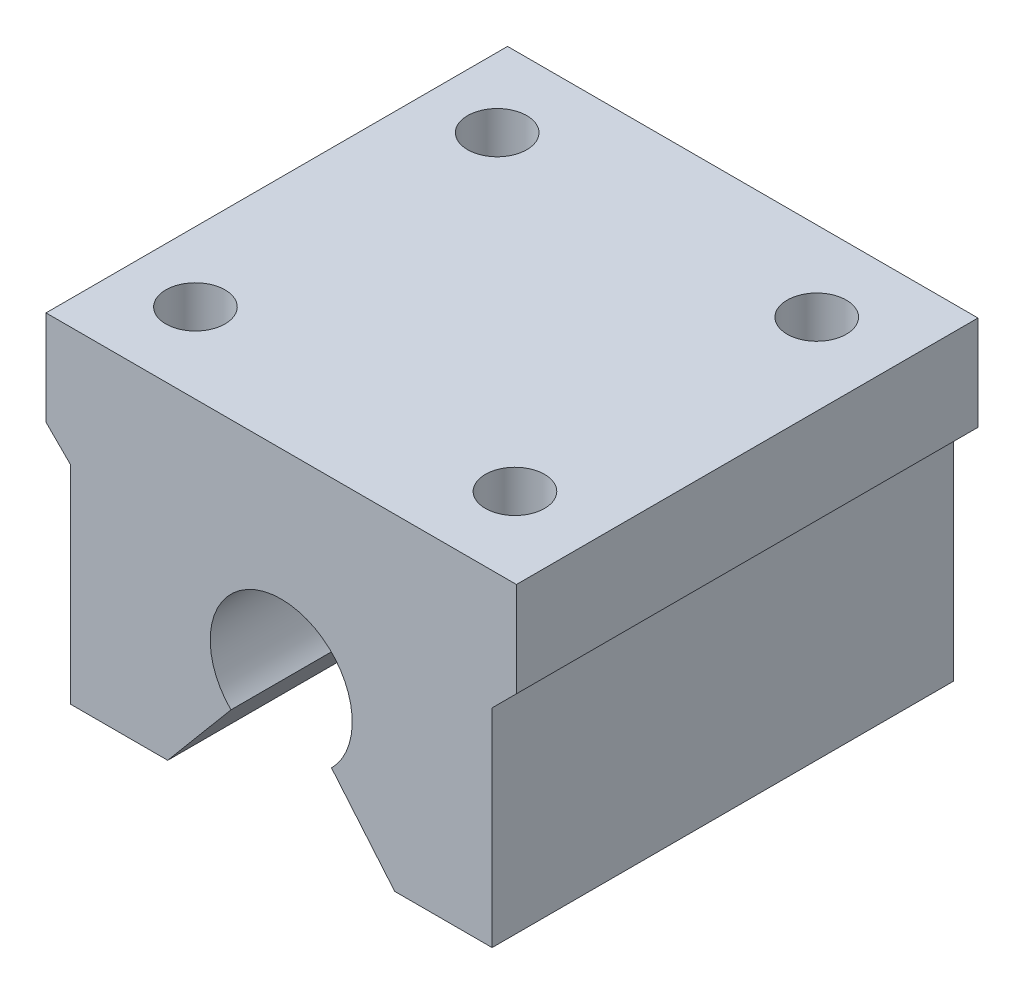
from build123d import *

# Parameters (mm, degrees)
BOSS_EXTRUDE1_DEPTH = 39
SKETCH2_R           = 2.5
CUT_EXTRUDE1_DEPTH  = 10


with BuildPart() as part:
    # Sketch1 → Boss-Extrude1 (new body)
    with BuildSketch(Plane.XY):
        with BuildLine():
            Line((19.875, 17), (-19.875, 17))
            Line((-19.875, 17), (-19.875, 9))
            Line((-19.875, 9), (-17.818455856, 6.943455856))
            Line((-17.818455856, 6.943455856), (-17.818455856, -10.6))
            Line((-17.818455856, -10.6), (-9.590643782, -10.6))
            Line((-9.590643782, -10.6), (-4.25, -4.235268587))
            ThreePointArc((-4.25, -4.235268587), (0, 6), (4.25, -4.235268587))
            Line((4.25, -4.235268587), (9.590643782, -10.6))
            Line((9.590643782, -10.6), (17.818455856, -10.6))
            Line((17.818455856, -10.6), (17.818455856, 6.943455856))
            Line((17.818455856, 6.943455856), (19.875, 9))
            Line((19.875, 9), (19.875, 17))
        make_face()
    extrude(amount=BOSS_EXTRUDE1_DEPTH)

    # Sketch2 → Cut-Extrude1 (cut)
    with BuildSketch(Plane(origin=(0, 17, 0), x_dir=(1, 0, 0), z_dir=(0, 1, 0))):
        with Locations((-14, -32.25)):
            Circle(SKETCH2_R)
        with Locations((13, -32.25)):
            Circle(SKETCH2_R)
        with Locations((-14, -6.75)):
            Circle(SKETCH2_R)
        with Locations((13, -6.75)):
            Circle(SKETCH2_R)
    extrude(amount=-CUT_EXTRUDE1_DEPTH, mode=Mode.SUBTRACT)


solid = part.part
